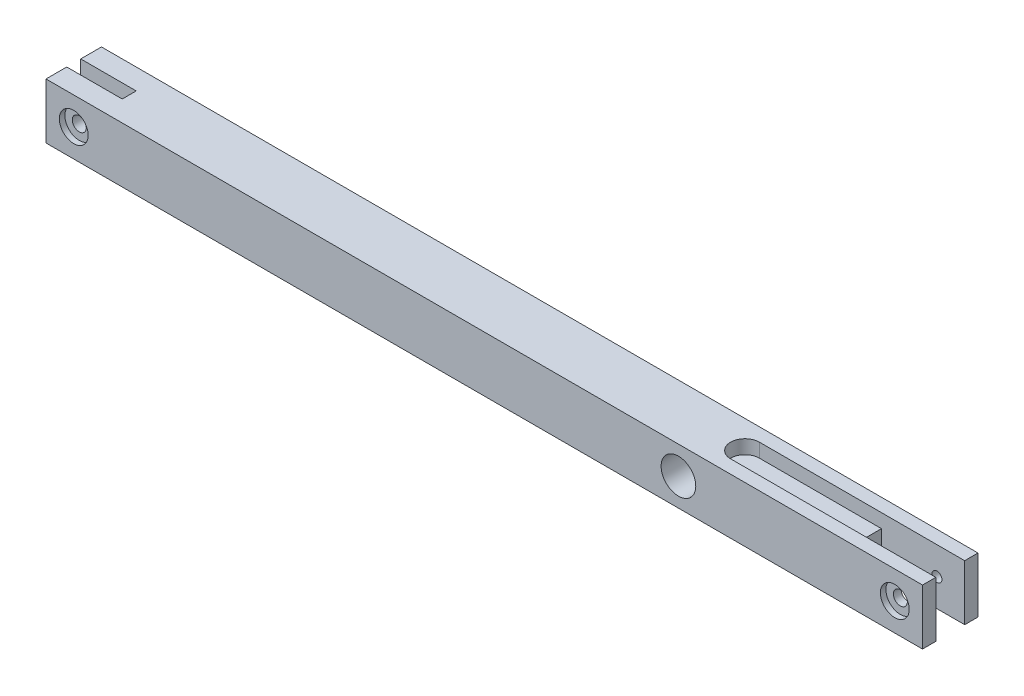
from build123d import *

# Parameters (mm, degrees)
BOSS_EXTRUDE1_DEPTH            = 55.88
BOSS_EXTRUDE1_DEPTH_BACK       = 144.78
SKETCH1_W                      = 12.7
SKETCH1_H                      = 12.7
F_5_16_0_3125_DIAMETER_HOLE2_D = 7.9375
SKETCH9_W                      = 6.604
SKETCH9_H                      = 12.7
CUT_EXTRUDE1_DEPTH             = 19.05
SKETCH19_W                     = 3.2004
SKETCH19_H                     = 12.7
CUT_EXTRUDE2_DEPTH             = 12.7
ADVANCEDHOLE2_START            = 5.08
ADVANCEDHOLE2_OUTLINE_R        = 3.302
ADVANCEDHOLE2_DEPTH            = 1.27
ADVANCEDHOLE2_START_2          = -6.35
ADVANCEDHOLE2_2_OUTLINE_R      = 1.1303
ADVANCEDHOLE2_2_DEPTH          = 11.43
ADVANCEDHOLE2_START_3          = 1.6002
ADVANCEDHOLE2_3_OUTLINE_R      = 1.6002
ADVANCEDHOLE2_3_OUTLINE_R_2    = 1.1303
ADVANCEDHOLE2_3_DEPTH          = 3.4798
CUT_EXTRUDE3_DEPTH             = 3.175


# Read off the part's stored shape, not the designer's step: AdvancedHole2
with BuildPart() as part:
    # Sketch1 → Boss-Extrude1 (new, two sides: drawn at the far end of the back side and taken through both)
    with BuildSketch(Plane(origin=(0, 0, 0), x_dir=(0, 0, -1), z_dir=(1, 0, 0)).offset(-BOSS_EXTRUDE1_DEPTH_BACK)):
        Rectangle(SKETCH1_W, SKETCH1_H)
    extrude(amount=BOSS_EXTRUDE1_DEPTH + BOSS_EXTRUDE1_DEPTH_BACK)

    # 5/16 (0.3125) Diameter Hole2 (through all)
    with Locations(Plane.XY.offset(6.35)):
        with Locations((0, 0)):
            Hole(F_5_16_0_3125_DIAMETER_HOLE2_D / 2)

    # Sketch9 → Cut-Extrude1 (cut)
    with BuildSketch(Plane(origin=(55.88, 0, 0), x_dir=(0, 0, -1), z_dir=(1, 0, 0))):
        Rectangle(SKETCH9_W, SKETCH9_H)
    extrude(amount=-CUT_EXTRUDE1_DEPTH, mode=Mode.SUBTRACT)

    # Sketch19 → Cut-Extrude2 (cut)
    with BuildSketch(Plane.ZY.offset(144.78)):
        Rectangle(SKETCH19_W, SKETCH19_H)
    extrude(amount=-CUT_EXTRUDE2_DEPTH, mode=Mode.SUBTRACT)

    # AdvancedHole2 outline → AdvancedHole2 (cut)
    with BuildSketch(Plane.XY.offset(ADVANCEDHOLE2_START)):
        with Locations((-138.43, 0)):
            Circle(ADVANCEDHOLE2_OUTLINE_R)
        with Locations((49.53, 0)):
            Circle(ADVANCEDHOLE2_OUTLINE_R)
    extrude(amount=ADVANCEDHOLE2_DEPTH, mode=Mode.SUBTRACT)

    # AdvancedHole2 2 outline → AdvancedHole2 2 (cut)
    with BuildSketch(Plane.XY.offset(ADVANCEDHOLE2_START_2)):
        with Locations((-138.43, 0)):
            Circle(ADVANCEDHOLE2_2_OUTLINE_R)
        with Locations((49.53, 0)):
            Circle(ADVANCEDHOLE2_2_OUTLINE_R)
    extrude(amount=ADVANCEDHOLE2_2_DEPTH, mode=Mode.SUBTRACT)

    # AdvancedHole2 3 outline → AdvancedHole2 3 (cut)
    # profile 1 of 2: a face of its own
    with BuildSketch(Plane.XY.offset(ADVANCEDHOLE2_START_3)):
        with Locations((-138.43, 0)):
            Circle(ADVANCEDHOLE2_3_OUTLINE_R)
        with Locations((-138.43, 0)):
            Circle(ADVANCEDHOLE2_3_OUTLINE_R_2, mode=Mode.SUBTRACT)
    # profile 2 of 2: a face of its own
    with BuildSketch(Plane.XY.offset(ADVANCEDHOLE2_START_3)):
        with Locations((49.53, 0)):
            Circle(ADVANCEDHOLE2_3_OUTLINE_R)
        with Locations((49.53, 0)):
            Circle(ADVANCEDHOLE2_3_OUTLINE_R_2, mode=Mode.SUBTRACT)
    extrude(amount=ADVANCEDHOLE2_3_DEPTH, mode=Mode.SUBTRACT)

    # Sketch20 → Cut-Extrude3 (cut)
    with BuildSketch(Plane(origin=(0, 6.35, 0), x_dir=(1, 0, 0), z_dir=(0, 1, 0))):
        with BuildLine():
            Line((36.83, -3.302), (8.89, -3.302))
            ThreePointArc((8.89, -3.302), (5.588, 0), (8.89, 3.302))
            Line((8.89, 3.302), (36.83, 3.302))
            ThreePointArc((36.83, 3.302), (40.132, 0), (36.83, -3.302))
        make_face()
    extrude(amount=-CUT_EXTRUDE3_DEPTH, mode=Mode.SUBTRACT)


solid = part.part
